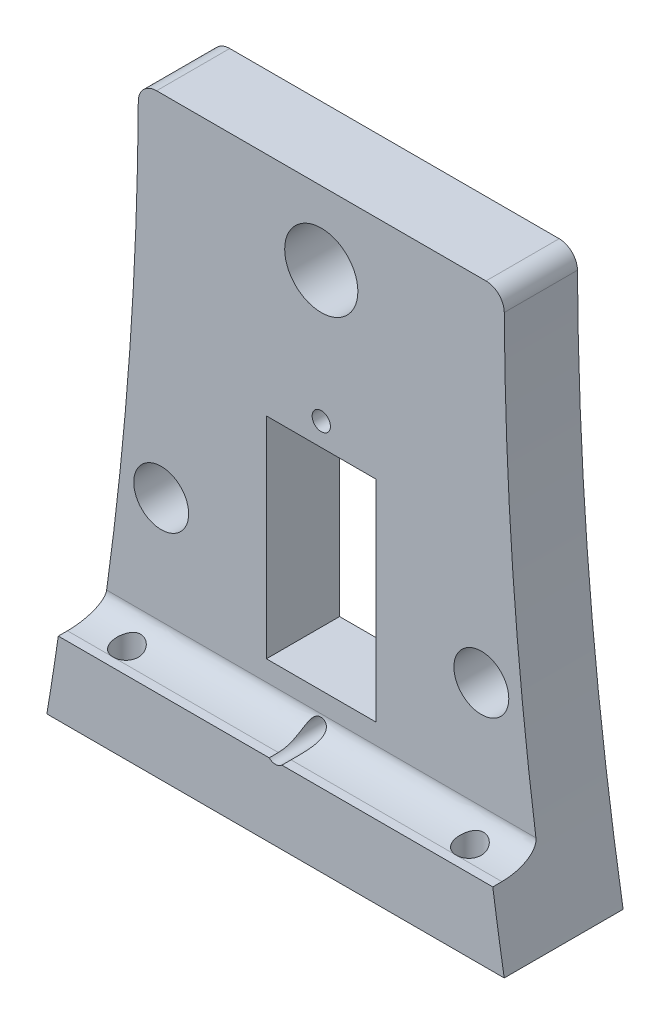
from build123d import *

# Parameters (mm, degrees)
BOSS_EXTRUDE1_DEPTH  = 8
BOSS_EXTRUDE2_DEPTH  = 5
SKETCH3_R            = 1.5
CUT_EXTRUDE_DEPTH    = 8
FILLET1_SIZE         = 4
FILLET1_SIZE_2       = 2
FILLET2_R            = 2
SKETCH4_R            = 4.0005
SKETCH4_R_2          = 4.725
SKETCH4_R_3          = 3
M4_H6_T_INSERT_DEPTH = 8
SKETCH12_R           = 1
SKETCH12_W           = 12
SKETCH12_H           = 23
CUT_EXTRUDE1_DEPTH   = 67.287253734


with BuildPart() as part:
    # Sketch1 → Boss-Extrude1 (new body)
    with BuildSketch(Plane.XY):
        with BuildLine():
            Line((20, 60), (-20, 60))
            ThreePointArc((-20, 60), (-21.252162636, 29.896013553), (-25, 0))
            Line((-25, 0), (25, 0))
            ThreePointArc((25, 0), (21.252162636, 29.896013553), (20, 60))
        make_face()
    extrude(amount=BOSS_EXTRUDE1_DEPTH)

    # Sketch2 → Boss-Extrude2 (add)
    with BuildSketch(Plane.XY.offset(8)):
        with BuildLine():
            Line((-25, 0), (25, 0))
            ThreePointArc((25, 0), (24.352183064, 3.996507037), (23.749041813, 8))
            Line((23.749041813, 8), (-23.749041813, 8))
            ThreePointArc((-23.749041813, 8), (-24.352183064, 3.996507037), (-25, 0))
        make_face()
    extrude(amount=BOSS_EXTRUDE2_DEPTH)

    # Sketch3 → Cut-Extrude (cut)
    with BuildSketch(Plane(origin=(0, 8, 0), x_dir=(1, 0, 0), z_dir=(0, 1, 0))):
        with Locations(Location((-18.749041813, -10.5, 0), (0, 0, 270))):
            Circle(SKETCH3_R)
        with Locations(Location((18.749041813, -10.5, 0), (0, 0, 270))):
            Circle(SKETCH3_R)
    extrude(amount=-CUT_EXTRUDE_DEPTH, mode=Mode.SUBTRACT)

    # Fillet1
    # an asymmetric fillet: 4, 2 mm, written as the material it adds along each edge
    with BuildSketch(Plane(origin=(33.749041813, 8, 8), x_dir=(0, 0, 1), z_dir=(-1, 0, 0))) as fillet1_piece_1_section:
        with BuildLine():
            Bezier((FILLET1_SIZE, 0), (0, 0), (0, FILLET1_SIZE_2), weights=[1, 0.707106781, 1])
            Line((0, FILLET1_SIZE_2), (-0.08, 2))
            Line((-0.08, 2), (-0.08, -0.08))
            Line((-0.08, -0.08), (4, -0.08))
            Line((4, -0.08), (FILLET1_SIZE, 0))
        make_face()
    fillet1_piece_1 = extrude(amount=67.498083626, mode=Mode.PRIVATE)
    fillet1_piece_1 = fillet1_piece_1 - Plane(origin=(382.5, 60, 8.944071766), x_dir=(-0.9862068965517241, -0.1655172413793104, 0), z_dir=(0, 0, -1)) * Cylinder(362.5, 151, mode=Mode.PRIVATE)
    fillet1_piece_1 = fillet1_piece_1 - Plane(origin=(-382.5, 60, 8.944071766), x_dir=(1, 0, 0), z_dir=(0, 0, -1)) * Cylinder(362.5, 151, mode=Mode.PRIVATE)
    fillet1_piece_1 = fillet1_piece_1 - Plane(origin=(-18.749041813, 8.425382089, 10.5), x_dir=(0, 0, 1), z_dir=(0, 1, 0)) * Cylinder(1.5, 151, mode=Mode.PRIVATE)
    fillet1_piece_1 = fillet1_piece_1 - Plane(origin=(18.749041813, 8.425382089, 10.5), x_dir=(0, 0, 1), z_dir=(0, 1, 0)) * Cylinder(1.5, 151, mode=Mode.PRIVATE)
    add(fillet1_piece_1)

    # Fillet2
    fillet2_edges = [part.edges().sort_by_distance(p)[0] for p in [
        (20, 60, 4),
        (-20, 60, 4),
    ]]
    fillet(fillet2_edges, radius=FILLET2_R)

    # Sketch4 → M4*H6 T-Insert (cut)
    with BuildSketch(Plane(origin=(0, 0, 0), x_dir=(-1, 0, 0), z_dir=(0, 0, -1))):
        with Locations((0, 52)):
            Circle(SKETCH4_R)
        with Locations((0, 29.37)):
            Circle(SKETCH4_R_2)
        with Locations((-17.5, 21.695)):
            Circle(SKETCH4_R_3)
        with Locations(Location((17.5, 21.695, 0), (0, 0, 180))):
            Circle(SKETCH4_R_3)
    extrude(amount=-M4_H6_T_INSERT_DEPTH, mode=Mode.SUBTRACT)

    # Sketch12 → Cut-Extrude1 (cut, through all)
    with BuildSketch(Plane(origin=(0, 0, 0), x_dir=(-1, 0, 0), z_dir=(0, 0, -1))):
        with Locations((0, 37.72)):
            Circle(SKETCH12_R)
        with Locations(Location((0, 8.72, 0), (0, 0, 313.945519562))):
            Circle(SKETCH12_R)
        with Locations((0, 23.72)):
            Rectangle(SKETCH12_W, SKETCH12_H)
    extrude(amount=-CUT_EXTRUDE1_DEPTH, mode=Mode.SUBTRACT)


solid = part.part
